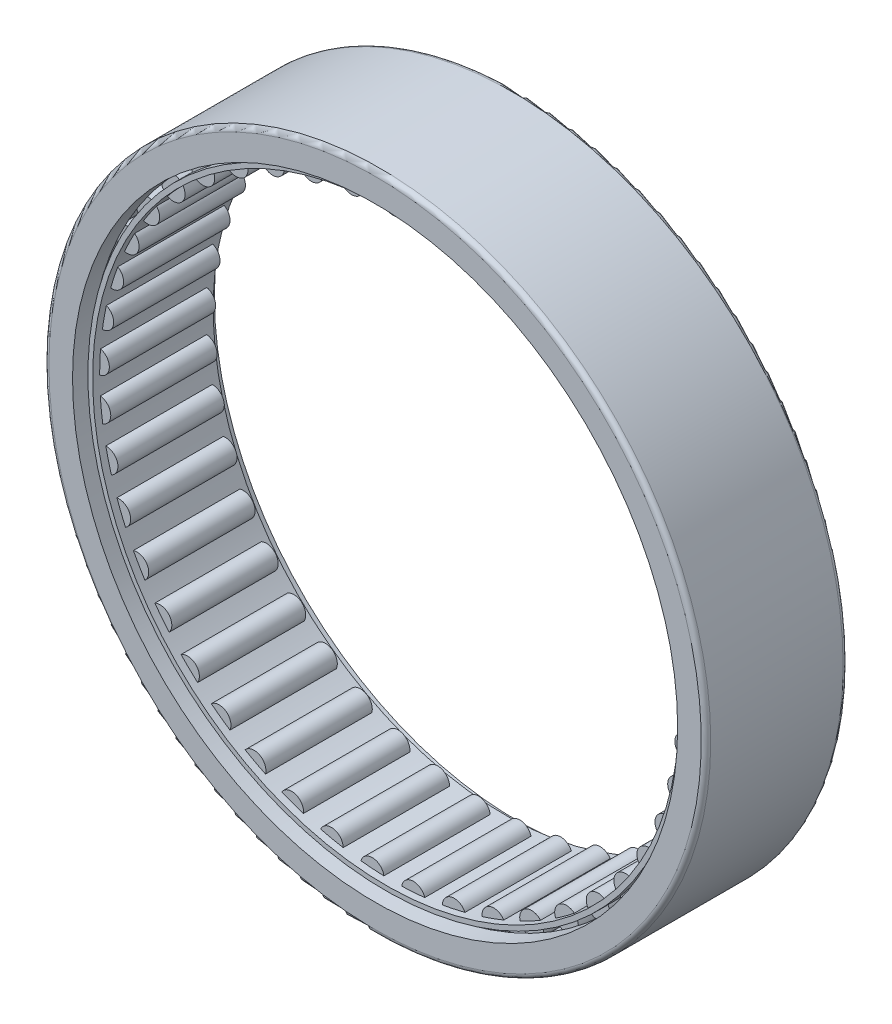
from build123d import *

# Parameters (mm, degrees)
BASESKE_W            = 22.5
BASESKE_H            = 2.5
CAGESKE_W            = 25.5
CAGESKE_H            = 1
FILLET1_R            = 1
CIRPATTERNBALL_COUNT = 45


with BuildPart() as part:
    # BaseSke → Roller (revolve)
    with BuildSketch(Plane(origin=(0, 0, 0), x_dir=(0, 0, -1), z_dir=(1, 0, 0))):
        with Locations((0, 61.25)):
            Rectangle(BASESKE_W, BASESKE_H)
    roller = revolve(axis=Axis((0, 62.5, 11.25), (0, 0, -1)))

    # OuterRaceSke → OuterRace (revolve)
    with BuildSketch(Plane(origin=(0, 0, 0), x_dir=(0, 0, -1), z_dir=(1, 0, 0))):
        Polygon((-15, 70), (15, 70), (15, 64), (11.275, 64), (11.275, 64.98), (-11.275, 64.98), (-11.275, 64), (-15, 64), align=None)
    revolve(axis=Axis((0, 0, 50.391616343), (0, 0, -1)))

    # CageSke → Cage (revolve)
    with BuildSketch(Plane(origin=(0, 0, 0), x_dir=(0, 0, -1), z_dir=(1, 0, 0))):
        with Locations((0, 62.5)):
            Rectangle(CAGESKE_W, CAGESKE_H)
    revolve(axis=Axis((0, 0, 70.862590906), (0, 0, -1)))

    # Fillet1
    fillet1_edges = [part.edges().sort_by_distance(p)[0] for p in [
        (0, -70, -15),
        (0, -70, 15),
    ]]
    fillet(fillet1_edges, radius=FILLET1_R)

    # CirPatternBall: Roller ×45 about axis
    cirpatternball_axis = Axis((0, 0, 50.391616343), (0, 0, -1))
    for i in range(1, CIRPATTERNBALL_COUNT):
        add(roller.rotate(cirpatternball_axis, i * 360 / CIRPATTERNBALL_COUNT))


solid = part.part
